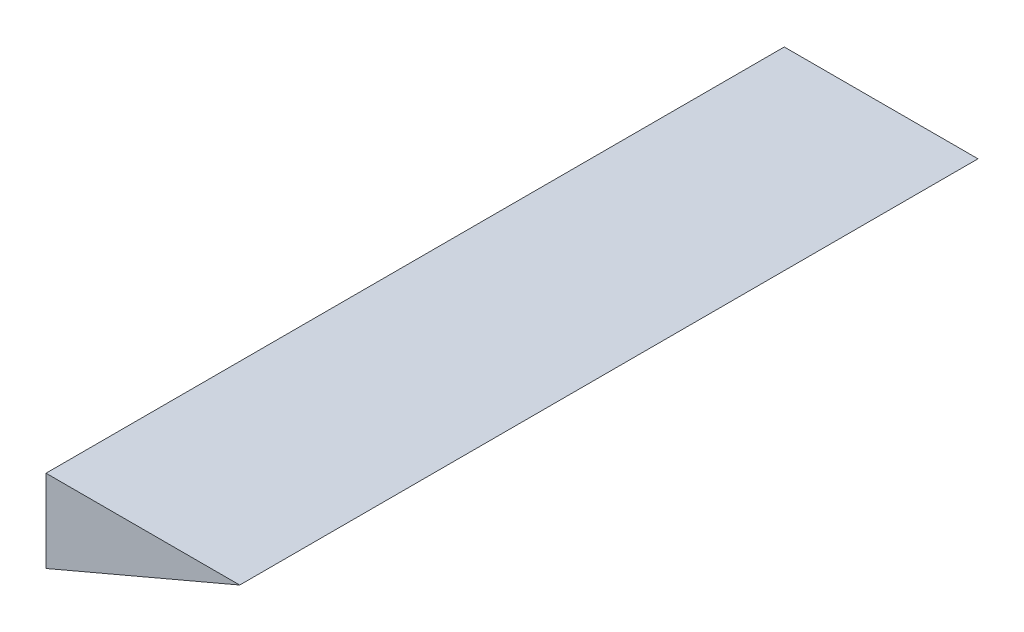
from build123d import *

# Parameters (mm, degrees)
AUFSATZ_LINEAR_AUSTRAGEN1_DEPTH = 200


with BuildPart() as part:
    # Skizze1 → Aufsatz-Linear austragen1 (new body)
    with BuildSketch(Plane.XY):
        Polygon((-188.551604042, 146.626566289), (-188.551604042, 124.272982641), (-136.069277217, 146.626566289), align=None)
    extrude(amount=AUFSATZ_LINEAR_AUSTRAGEN1_DEPTH)


solid = part.part
